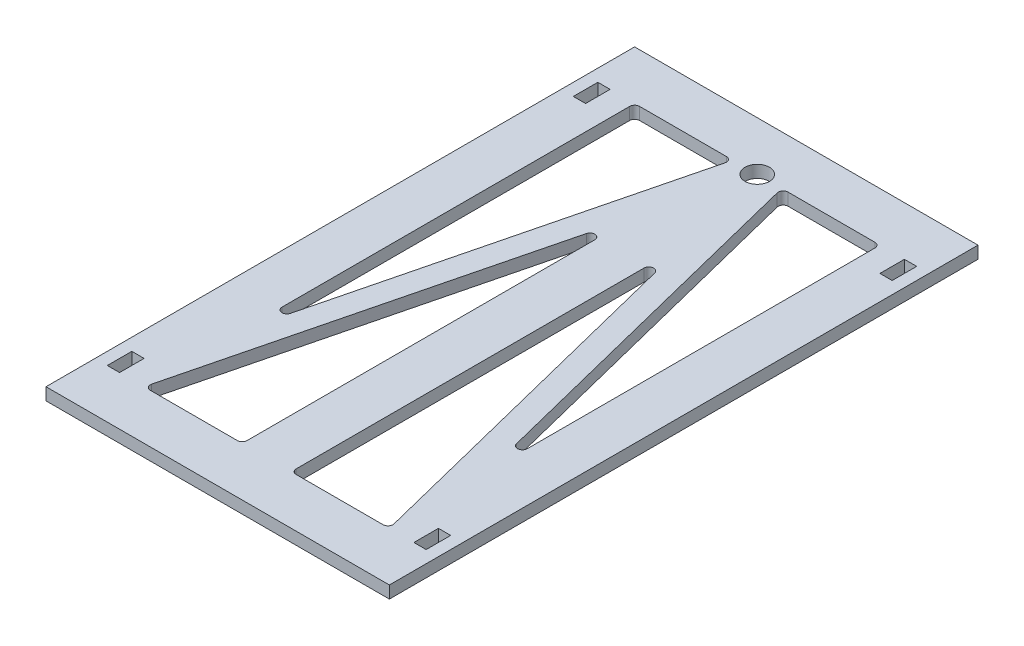
from build123d import *

# Parameters (mm, degrees)
SKETCH1_W         = 6.35
SKETCH1_H         = 12.7
SKETCH1_R         = 6.35
FRONT_PANEL_DEPTH = 6.35
FILLET1_R         = 2.54


with BuildPart() as part:
    # Sketch1 → Front Panel (new body)
    with BuildSketch(Plane(origin=(0, 0, 0), x_dir=(1, 0, 0), z_dir=(0, 1, 0))):
        Polygon((0, 304.8), (0, 0), (12.7, 0), (50.8, 0), (63.5, 0), (114.3, 0), (127, 0), (165.1, 0), (177.8, 0), (177.8, 304.8), align=None)
        with Locations((9.525, 31.75)):
            Rectangle(SKETCH1_W, SKETCH1_H, mode=Mode.SUBTRACT)
        Polygon((25.4, 25.4), (76.2, 228.6), (76.2, 25.4), align=None, mode=Mode.SUBTRACT)
        with Locations((168.275, 31.75)):
            Rectangle(SKETCH1_W, SKETCH1_H, mode=Mode.SUBTRACT)
        Polygon((101.6, 25.4), (101.6, 228.6), (152.4, 25.4), align=None, mode=Mode.SUBTRACT)
        Polygon((25.4, 279.4), (76.2, 279.4), (25.4, 76.2), align=None, mode=Mode.SUBTRACT)
        with Locations((9.525, 273.05)):
            Rectangle(SKETCH1_W, SKETCH1_H, mode=Mode.SUBTRACT)
        Polygon((152.4, 76.2), (101.6, 279.4), (152.4, 279.4), align=None, mode=Mode.SUBTRACT)
        with Locations((88.9, 279.4)):
            Circle(SKETCH1_R, mode=Mode.SUBTRACT)
        with Locations((168.275, 273.05)):
            Rectangle(SKETCH1_W, SKETCH1_H, mode=Mode.SUBTRACT)
    extrude(amount=FRONT_PANEL_DEPTH)

    # Fillet1
    fillet1_edges = [part.edges().sort_by_distance(p)[0] for p in [
        (25.4, 3.175, -76.2),
        (152.4, 3.175, -76.2),
        (25.4, 3.175, -25.4),
        (76.2, 3.175, -25.4),
        (101.6, 3.175, -25.4),
        (152.4, 3.175, -25.4),
        (76.2, 3.175, -228.6),
        (101.6, 3.175, -228.6),
        (25.4, 3.175, -279.4),
        (76.2, 3.175, -279.4),
        (101.6, 3.175, -279.4),
        (152.4, 3.175, -279.4),
    ]]
    fillet(fillet1_edges, radius=FILLET1_R)


solid = part.part
